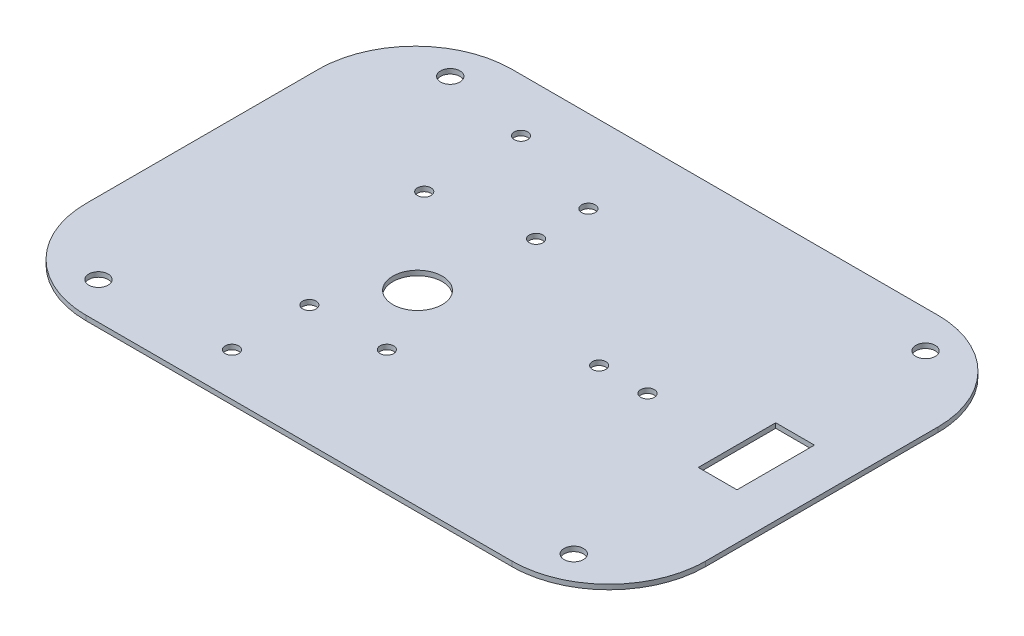
from build123d import *

# Parameters (mm, degrees)
SKETCH1_W                       = 320
SKETCH1_H                       = 220
THE_UPPER_CHASISS_DEPTH         = 1.25
BATTARY_REACH                   = 196.169
SKETCH2_R                       = 3.5
BATTARY_DIRECTION_2_REACH       = 196.169
POWER_SECTION_REACH             = 196.169
SKETCH3_R                       = 3.5
POWER_SECTION_DIRECTION_2_REACH = 196.169
ARDUINO_R                       = 3.5
ARDUINO_SECTION_DEPTH           = 2.5
SKETCH7_R                       = 5
LINK_NAILS_DEPTH                = 2.5
SKETCH9_W                       = 20
SKETCH9_H                       = 40
RECT_CUT_DEPTH                  = 2.5
SKETCH10_R                      = 12.759028862
CIRC_CUT_DEPTH                  = 2.5
FILLET4_R                       = 50


with BuildPart() as part:
    # Sketch1 → the upper chasiss (new, symmetric)
    with BuildSketch(Plane(origin=(0, 0, 0), x_dir=(1, 0, 0), z_dir=(0, 1, 0))):
        Rectangle(SKETCH1_W, SKETCH1_H)
    extrude(amount=THE_UPPER_CHASISS_DEPTH, both=True)

    # Battary: up to this face of the body (flat: up to its plane)
    battary_end = Plane(part.part.faces().sort_by_distance((0, 1.25, 0))[0])
    # Sketch2 → Battary (cut, up to the picked face)
    with BuildSketch(Plane(origin=(0, 0, 0), x_dir=(1, 0, 0), z_dir=(0, 1, 0)), mode=Mode.PRIVATE) as battary_sk1:
        with Locations((70, 0)):
            Circle(SKETCH2_R)
    battary_tool1 = split(extrude(battary_sk1.sketch, amount=BATTARY_REACH, mode=Mode.PRIVATE), bisect_by=battary_end, keep=Keep.BOTH, mode=Mode.PRIVATE)
    # Sketch2 → Battary (cut, up to the picked face)
    with BuildSketch(Plane(origin=(0, 0, 0), x_dir=(1, 0, 0), z_dir=(0, 1, 0)), mode=Mode.PRIVATE) as battary_sk2:
        with Locations((45, 0)):
            Circle(SKETCH2_R)
    battary_tool2 = split(extrude(battary_sk2.sketch, amount=BATTARY_REACH, mode=Mode.PRIVATE), bisect_by=battary_end, keep=Keep.BOTH, mode=Mode.PRIVATE)
    add(battary_tool1.solids().sort_by(Axis((70, 0, 0), (0, 1, 0)))[0], mode=Mode.SUBTRACT)
    add(battary_tool2.solids().sort_by(Axis((45, 0, 0), (0, 1, 0)))[0], mode=Mode.SUBTRACT)

    # Battary direction 2: up to this face of the body (flat: up to its plane)
    battary_direction_2_end = Plane(part.part.faces().sort_by_distance((0, -1.25, 0))[0])
    # Sketch2 → Battary direction 2 (cut, up to the picked face)
    with BuildSketch(Plane(origin=(0, 0, 0), x_dir=(1, 0, 0), z_dir=(0, 1, 0)), mode=Mode.PRIVATE) as battary_direction_2_sk1:
        with Locations((70, 0)):
            Circle(SKETCH2_R)
    battary_direction_2_tool1 = split(extrude(battary_direction_2_sk1.sketch, amount=-BATTARY_DIRECTION_2_REACH, mode=Mode.PRIVATE), bisect_by=battary_direction_2_end, keep=Keep.BOTH, mode=Mode.PRIVATE)
    # Sketch2 → Battary direction 2 (cut, up to the picked face)
    with BuildSketch(Plane(origin=(0, 0, 0), x_dir=(1, 0, 0), z_dir=(0, 1, 0)), mode=Mode.PRIVATE) as battary_direction_2_sk2:
        with Locations((45, 0)):
            Circle(SKETCH2_R)
    battary_direction_2_tool2 = split(extrude(battary_direction_2_sk2.sketch, amount=-BATTARY_DIRECTION_2_REACH, mode=Mode.PRIVATE), bisect_by=battary_direction_2_end, keep=Keep.BOTH, mode=Mode.PRIVATE)
    add(battary_direction_2_tool1.solids().sort_by(Axis((70, 0, 0), (0, -1, 0)))[0], mode=Mode.SUBTRACT)
    add(battary_direction_2_tool2.solids().sort_by(Axis((45, 0, 0), (0, -1, 0)))[0], mode=Mode.SUBTRACT)

    # power section: up to this face of the body (flat: up to its plane)
    power_section_end = Plane(part.part.faces().sort_by_distance((-0.062934128, -1.25, 0))[0])
    # Sketch3 → power section (cut, up to the picked face)
    with BuildSketch(Plane(origin=(0, 0, 0), x_dir=(1, 0, 0), z_dir=(0, 1, 0)), mode=Mode.PRIVATE) as power_section_sk1:
        with Locations((-56.898371951, -47.760148577)):
            Circle(SKETCH3_R)
    power_section_tool1 = split(extrude(power_section_sk1.sketch, amount=-POWER_SECTION_REACH, mode=Mode.PRIVATE), bisect_by=power_section_end, keep=Keep.BOTH, mode=Mode.PRIVATE)
    # Sketch3 → power section (cut, up to the picked face)
    with BuildSketch(Plane(origin=(0, 0, 0), x_dir=(1, 0, 0), z_dir=(0, 1, 0)), mode=Mode.PRIVATE) as power_section_sk2:
        with Locations((-16.898371951, -47.760148577)):
            Circle(SKETCH3_R)
    power_section_tool2 = split(extrude(power_section_sk2.sketch, amount=-POWER_SECTION_REACH, mode=Mode.PRIVATE), bisect_by=power_section_end, keep=Keep.BOTH, mode=Mode.PRIVATE)
    # Sketch3 → power section (cut, up to the picked face)
    with BuildSketch(Plane(origin=(0, 0, 0), x_dir=(1, 0, 0), z_dir=(0, 1, 0)), mode=Mode.PRIVATE) as power_section_sk3:
        with Locations((-56.898371951, -87.760148577)):
            Circle(SKETCH3_R)
    power_section_tool3 = split(extrude(power_section_sk3.sketch, amount=-POWER_SECTION_REACH, mode=Mode.PRIVATE), bisect_by=power_section_end, keep=Keep.BOTH, mode=Mode.PRIVATE)
    add(power_section_tool1.solids().sort_by(Axis((-56.898372, 0, 47.760149), (0, -1, 0)))[0], mode=Mode.SUBTRACT)
    add(power_section_tool2.solids().sort_by(Axis((-16.898372, 0, 47.760149), (0, -1, 0)))[0], mode=Mode.SUBTRACT)
    add(power_section_tool3.solids().sort_by(Axis((-56.898372, 0, 87.760149), (0, -1, 0)))[0], mode=Mode.SUBTRACT)

    # power section direction 2: up to this face of the body (flat: up to its plane)
    power_section_direction_2_end = Plane(part.part.faces().sort_by_distance((-0.062934128, 1.25, 0))[0])
    # Sketch3 → power section direction 2 (cut, up to the picked face)
    with BuildSketch(Plane(origin=(0, 0, 0), x_dir=(1, 0, 0), z_dir=(0, 1, 0)), mode=Mode.PRIVATE) as power_section_direction_2_sk1:
        with Locations((-56.898371951, -47.760148577)):
            Circle(SKETCH3_R)
    power_section_direction_2_tool1 = split(extrude(power_section_direction_2_sk1.sketch, amount=POWER_SECTION_DIRECTION_2_REACH, mode=Mode.PRIVATE), bisect_by=power_section_direction_2_end, keep=Keep.BOTH, mode=Mode.PRIVATE)
    # Sketch3 → power section direction 2 (cut, up to the picked face)
    with BuildSketch(Plane(origin=(0, 0, 0), x_dir=(1, 0, 0), z_dir=(0, 1, 0)), mode=Mode.PRIVATE) as power_section_direction_2_sk2:
        with Locations((-16.898371951, -47.760148577)):
            Circle(SKETCH3_R)
    power_section_direction_2_tool2 = split(extrude(power_section_direction_2_sk2.sketch, amount=POWER_SECTION_DIRECTION_2_REACH, mode=Mode.PRIVATE), bisect_by=power_section_direction_2_end, keep=Keep.BOTH, mode=Mode.PRIVATE)
    # Sketch3 → power section direction 2 (cut, up to the picked face)
    with BuildSketch(Plane(origin=(0, 0, 0), x_dir=(1, 0, 0), z_dir=(0, 1, 0)), mode=Mode.PRIVATE) as power_section_direction_2_sk3:
        with Locations((-56.898371951, -87.760148577)):
            Circle(SKETCH3_R)
    power_section_direction_2_tool3 = split(extrude(power_section_direction_2_sk3.sketch, amount=POWER_SECTION_DIRECTION_2_REACH, mode=Mode.PRIVATE), bisect_by=power_section_direction_2_end, keep=Keep.BOTH, mode=Mode.PRIVATE)
    add(power_section_direction_2_tool1.solids().sort_by(Axis((-56.898372, 0, 47.760149), (0, 1, 0)))[0], mode=Mode.SUBTRACT)
    add(power_section_direction_2_tool2.solids().sort_by(Axis((-16.898372, 0, 47.760149), (0, 1, 0)))[0], mode=Mode.SUBTRACT)
    add(power_section_direction_2_tool3.solids().sort_by(Axis((-56.898372, 0, 87.760149), (0, 1, 0)))[0], mode=Mode.SUBTRACT)

    # arduino → arduino section (cut, symmetric)
    with BuildSketch(Plane(origin=(0, 0, 0), x_dir=(1, 0, 0), z_dir=(0, 1, 0))):
        with Locations((-77.933527642, 82.588848983)):
            Circle(ARDUINO_R)
        with Locations((-77.933527642, 32.588848983)):
            Circle(ARDUINO_R)
        with Locations((-27.933527642, 67.388848983)):
            Circle(ARDUINO_R)
        with Locations((-27.933527642, 40.388848983)):
            Circle(ARDUINO_R)
    extrude(amount=ARDUINO_SECTION_DEPTH, both=True, mode=Mode.SUBTRACT)

    # Sketch7 → link nails (cut, symmetric)
    with BuildSketch(Plane(origin=(0, 1.25, 0), x_dir=(1, 0, 0), z_dir=(0, 1, 0))):
        with Locations((-122.762547967, -90.864975812)):
            Circle(SKETCH7_R)
        with Locations((-122.762547967, 90.864975812)):
            Circle(SKETCH7_R)
        with Locations((122.762547967, -90.864975812)):
            Circle(SKETCH7_R)
        with Locations((122.762547967, 90.864975812)):
            Circle(SKETCH7_R)
    extrude(amount=LINK_NAILS_DEPTH, both=True, mode=Mode.SUBTRACT)

    # Sketch9 → rect cut (cut, symmetric)
    with BuildSketch(Plane(origin=(0, 1.25, 0), x_dir=(1, 0, 0), z_dir=(0, 1, 0))):
        with Locations((126.210934146, 0)):
            Rectangle(SKETCH9_W, SKETCH9_H)
    extrude(amount=RECT_CUT_DEPTH, both=True, mode=Mode.SUBTRACT)

    # Sketch10 → circ cut (cut, symmetric)
    with BuildSketch(Plane(origin=(0, 1.25, 0), x_dir=(1, 0, 0), z_dir=(0, 1, 0))):
        with Locations((-35.518377642, -13.276286789)):
            Circle(SKETCH10_R)
    extrude(amount=CIRC_CUT_DEPTH, both=True, mode=Mode.SUBTRACT)

    # Fillet4
    fillet4_edges = [part.edges().sort_by_distance(p)[0] for p in [
        (-160, 0, 110),
        (160, 0, 110),
        (160, 0, -110),
        (-160, 0, -110),
    ]]
    fillet(fillet4_edges, radius=FILLET4_R)


solid = part.part
